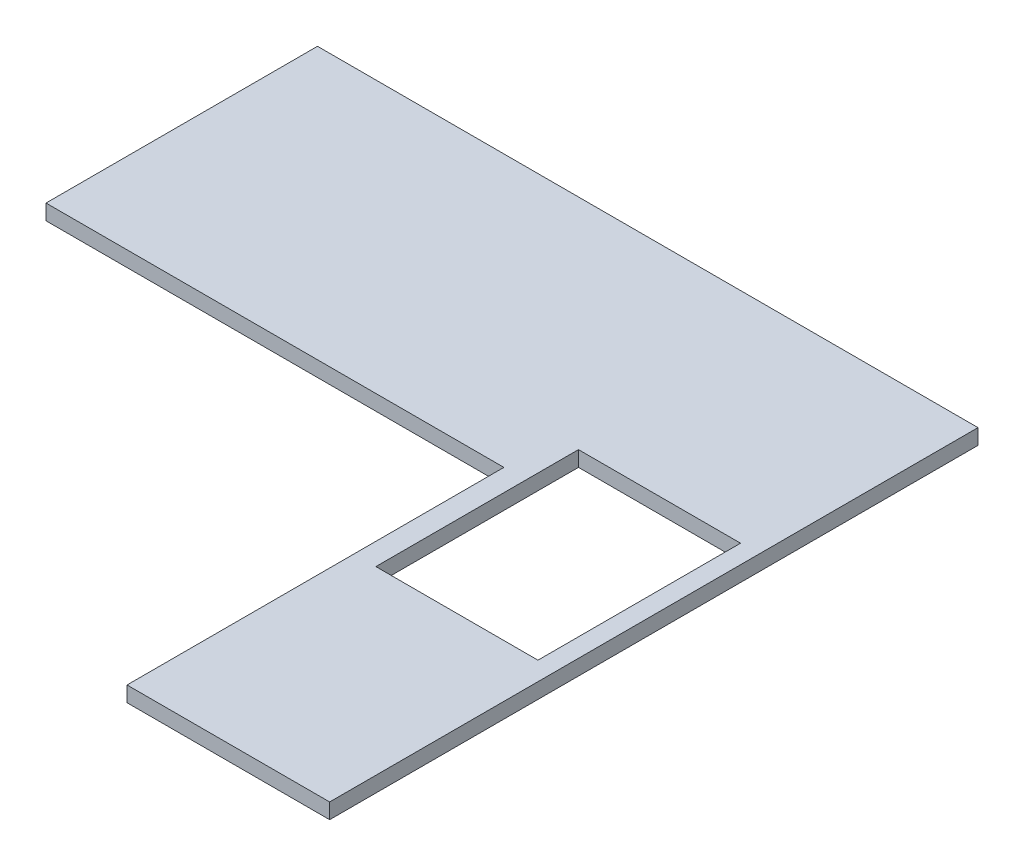
from build123d import *

# Parameters (mm, degrees)
EXTRUDE_1_DEPTH     = 38
SKETCH_2_W          = 400
SKETCH_2_H          = 500
CUT_EXTRUDE_1_DEPTH = 1878.03063374


with BuildPart() as part:
    # Эскиз1 → Бобышка-Вытянуть1 (new body)
    with BuildSketch(Plane(origin=(0, 0, 0), x_dir=(1, 0, 0), z_dir=(0, 1, 0))):
        Polygon((0, 0), (0, 670), (1630, 670), (1630, -930), (1130, -930), (1130, 0), align=None)
    extrude(amount=EXTRUDE_1_DEPTH)

    # Эскиз2 → Вырез-Вытянуть1 (cut, through all)
    with BuildSketch(Plane(origin=(0, 38, 0), x_dir=(1, 0, 0), z_dir=(0, 1, 0))):
        with Locations((1384.020539099, -119.97000375)):
            Rectangle(SKETCH_2_W, SKETCH_2_H)
    extrude(amount=-CUT_EXTRUDE_1_DEPTH, mode=Mode.SUBTRACT)


solid = part.part
